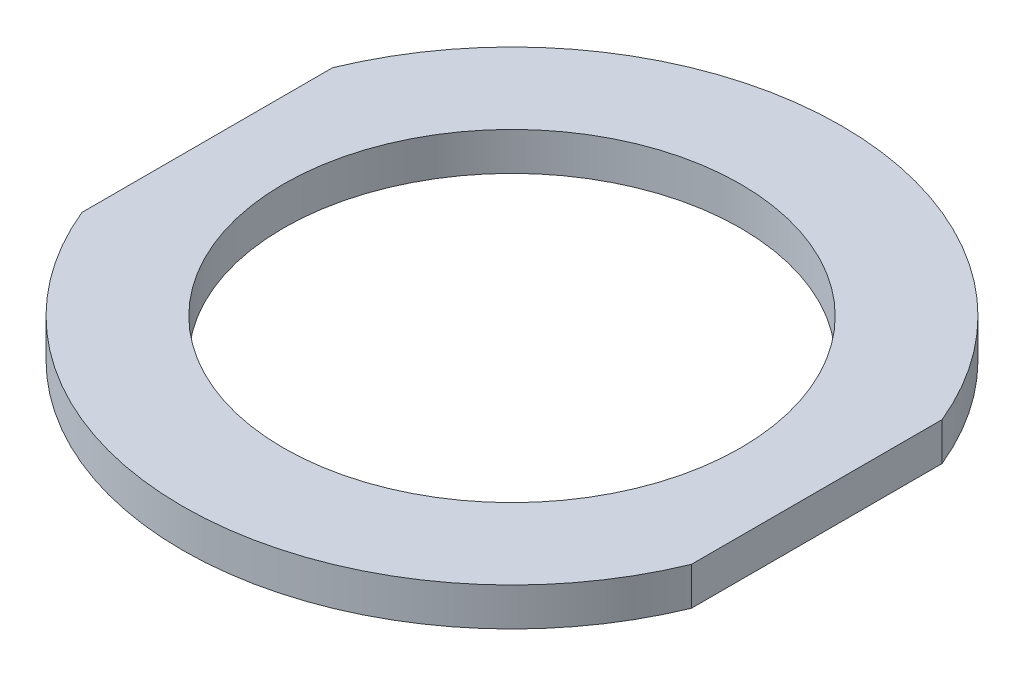
from build123d import *

# Parameters (mm, degrees)
SKETCH1_R           = 12
BOSS_EXTRUDE1_DEPTH = 2


with BuildPart() as part:
    # Sketch1 → Boss-Extrude1 (new body)
    with BuildSketch(Plane(origin=(0, 0, 0), x_dir=(1, 0, 0), z_dir=(0, 1, 0))):
        with BuildLine():
            Line((-16, 6.57951366), (-16, -6.57951366))
            ThreePointArc((-16, -6.57951366), (0, -17.3), (16, -6.57951366))
            Line((16, -6.57951366), (16, 6.57951366))
            ThreePointArc((16, 6.57951366), (0, 17.3), (-16, 6.57951366))
        make_face()
        Circle(SKETCH1_R, mode=Mode.SUBTRACT)
    extrude(amount=BOSS_EXTRUDE1_DEPTH)


solid = part.part
